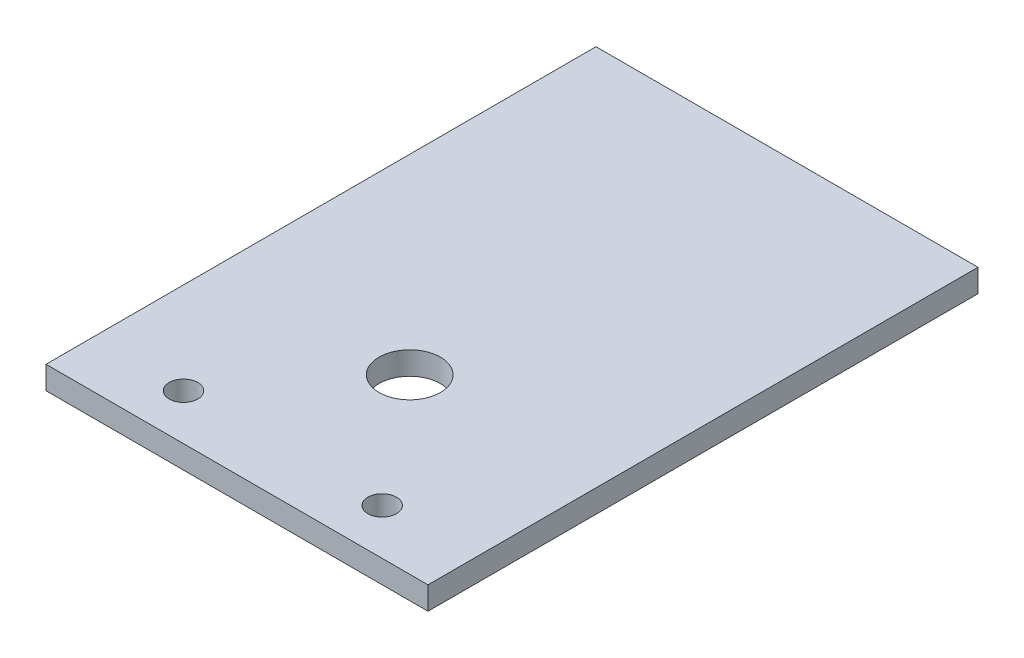
from build123d import *

# Parameters (mm, degrees)
SKETCH1_W           = 105.849999898
SKETCH1_H           = 152.4
BOSS_EXTRUDE1_DEPTH = 6.35
CUT_EXTRUDE1_REACH  = 94.994
SKETCH2_R           = 3.96875
SKETCH2_R_2         = 8.5


with BuildPart() as part:
    # Sketch1 → Boss-Extrude1 (new body)
    with BuildSketch(Plane(origin=(0, 0, 0), x_dir=(1, 0, 0), z_dir=(0, 1, 0))):
        Rectangle(SKETCH1_W, SKETCH1_H)
    extrude(amount=BOSS_EXTRUDE1_DEPTH)

    # Sketch2 → Cut-Extrude1 (cut, up to next)
    with BuildSketch(Plane(origin=(0, 6.35, 0), x_dir=(1, 0, 0), z_dir=(0, 1, 0)), mode=Mode.PRIVATE) as cut_extrude1_sk1:
        with Locations((-27.524999949, -63.5)):
            Circle(SKETCH2_R)
    cut_extrude1_tool1 = extrude(cut_extrude1_sk1.sketch, amount=-CUT_EXTRUDE1_REACH, mode=Mode.PRIVATE) & part.part
    # Sketch2 → Cut-Extrude1 (cut, up to next)
    with BuildSketch(Plane(origin=(0, 6.35, 0), x_dir=(1, 0, 0), z_dir=(0, 1, 0)), mode=Mode.PRIVATE) as cut_extrude1_sk2:
        with Locations((27.524999949, -63.5)):
            Circle(SKETCH2_R)
    cut_extrude1_tool2 = extrude(cut_extrude1_sk2.sketch, amount=-CUT_EXTRUDE1_REACH, mode=Mode.PRIVATE) & part.part
    # Sketch2 → Cut-Extrude1 (cut, up to next)
    with BuildSketch(Plane(origin=(0, 6.35, 0), x_dir=(1, 0, 0), z_dir=(0, 1, 0)), mode=Mode.PRIVATE) as cut_extrude1_sk3:
        with Locations((0, -28.34)):
            Circle(SKETCH2_R_2)
    cut_extrude1_tool3 = extrude(cut_extrude1_sk3.sketch, amount=-CUT_EXTRUDE1_REACH, mode=Mode.PRIVATE) & part.part
    add(cut_extrude1_tool1.solids().sort_by_distance((-27.525, 6.35, 63.5))[0], mode=Mode.SUBTRACT)
    add(cut_extrude1_tool2.solids().sort_by_distance((27.525, 6.35, 63.5))[0], mode=Mode.SUBTRACT)
    add(cut_extrude1_tool3.solids().sort_by_distance((0, 6.35, 28.34))[0], mode=Mode.SUBTRACT)


solid = part.part
